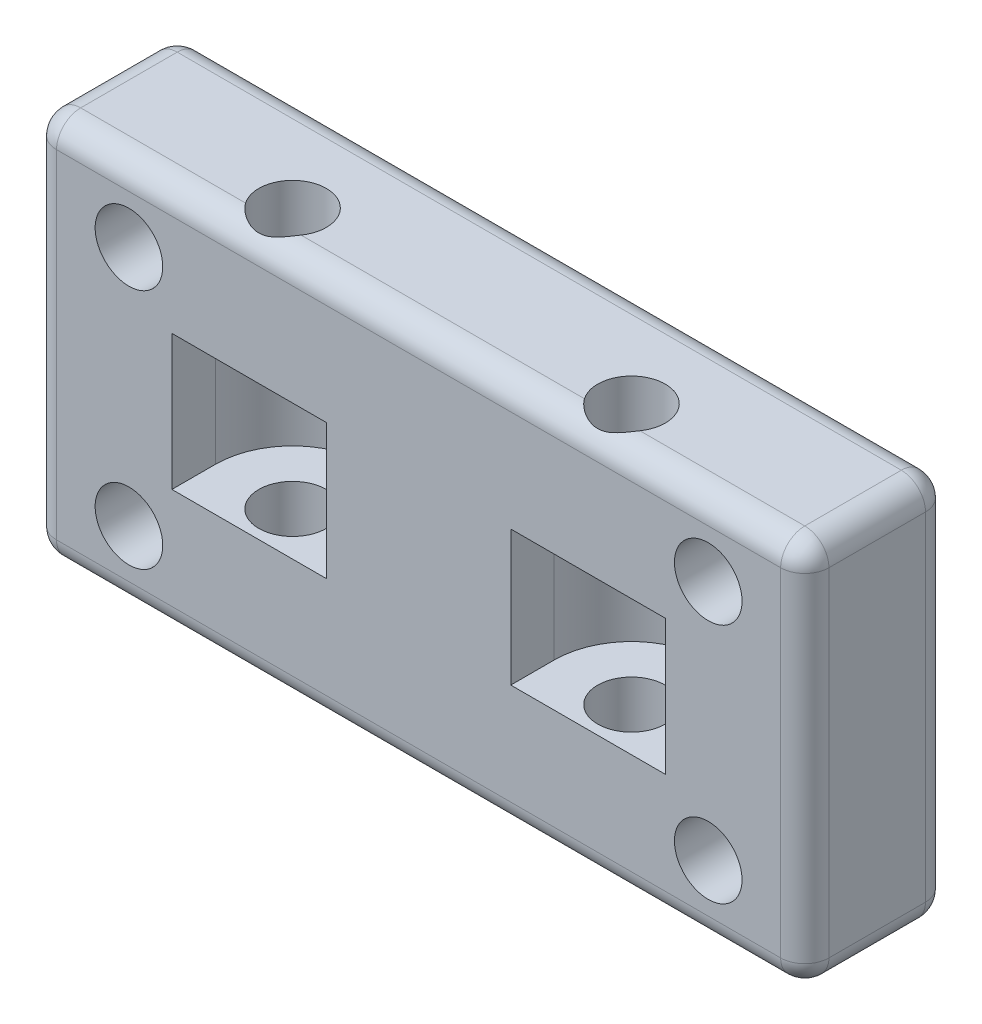
from build123d import *

# Parameters (mm, degrees)
SKETCH1_W               = 50.8
SKETCH1_H               = 25.4
BOSS_EXTRUDE1_DEPTH     = 9.525
CUT_EXTRUDE2_DEPTH      = 4.445
SKETCH2_R               = 2.2225
CUT_EXTRUDE1_DEPTH      = 9.525
CUT_EXTRUDE3_START      = -38.162422217
SKETCH5_R               = 2.2225
CUT_EXTRUDE3_DEPTH      = 41.337422217
MIRROR2_COPY_1_SKETCH_R = 2.2225
MIRROR2_COPY_1_DEPTH    = 9.525
FILLET1_R               = 1.5875


with BuildPart() as part:
    # Sketch1 → Boss-Extrude1 (new body)
    with BuildSketch(Plane.XY):
        Rectangle(SKETCH1_W, SKETCH1_H)
    extrude(amount=BOSS_EXTRUDE1_DEPTH)

    # Sketch4 → Cut-Extrude2 (cut, symmetric)
    with BuildSketch(Plane(origin=(0, 0, 0), x_dir=(1, 0, 0), z_dir=(0, 1, 0))):
        with BuildLine():
            Line((-16.22425, -6.6675), (-16.22425, -9.525))
            Line((-16.22425, -9.525), (-6.06425, -9.525))
            Line((-6.06425, -9.525), (-6.06425, -6.6675))
            ThreePointArc((-6.06425, -6.6675), (-11.14425, -1.5875), (-16.22425, -6.6675))
        make_face()
    cut_extrude2 = extrude(amount=CUT_EXTRUDE2_DEPTH, both=True, mode=Mode.SUBTRACT)

    # Sketch2 → Cut-Extrude1 (cut)
    with BuildSketch(Plane.XY.offset(9.525)):
        with Locations((-19.05, 7.9375)):
            Circle(SKETCH2_R)
    cut_extrude1 = extrude(amount=-CUT_EXTRUDE1_DEPTH, mode=Mode.SUBTRACT)

    # Sketch5 → Cut-Extrude3 (cut)
    with BuildSketch(Plane(origin=(0, 12.7, 0), x_dir=(1, 0, 0), z_dir=(0, 1, 0)).offset(CUT_EXTRUDE3_START)):
        with Locations(Location((-11.14425, -6.6675, 0), (0, 0, 180))):
            Circle(SKETCH5_R)
    cut_extrude3 = extrude(amount=CUT_EXTRUDE3_DEPTH, mode=Mode.SUBTRACT)

    # Mirror1: Cut-Extrude1 across plane
    add(cut_extrude1.mirror(Plane.ZX), mode=Mode.SUBTRACT)

    # Mirror2: Cut-Extrude2, Cut-Extrude1, Cut-Extrude3 across plane
    add(cut_extrude2.mirror(Plane.ZY), mode=Mode.SUBTRACT)
    add(cut_extrude1.mirror(Plane.ZY), mode=Mode.SUBTRACT)
    add(cut_extrude3.mirror(Plane.ZY), mode=Mode.SUBTRACT)

    # Mirror2 copy 1 sketch → Mirror2 copy 1 (cut)
    with BuildSketch(Plane(origin=(0, 0, 9.525), x_dir=(-1, 0, 0), z_dir=(0, 0, 1))):
        with Locations((-19.05, 7.9375)):
            Circle(MIRROR2_COPY_1_SKETCH_R)
    extrude(amount=-MIRROR2_COPY_1_DEPTH, mode=Mode.SUBTRACT)

    # Fillet1
    # the kernel refuses this fillet: 1.5875 mm, written as the material it takes off along each edge
    with BuildSketch(Plane(origin=(-23.8125, 11.1125, 7.9375), x_dir=(0, 1, 0), z_dir=(-1, 0, 0))) as fillet1_piece_1_section:
        Polygon((0, 0), (FILLET1_R, 0), (FILLET1_R, -FILLET1_R), (0, -FILLET1_R), align=None)
    fillet1_piece_1 = extrude(amount=FILLET1_R, mode=Mode.PRIVATE)
    fillet1_piece_1 = fillet1_piece_1 - Plane(origin=(-23.8125, 11.1125, 7.9375), x_dir=(0, -0.7071067811865475, -0.7071067811865475), z_dir=(-1, 0, 0)) * Sphere(FILLET1_R, mode=Mode.PRIVATE)
    add(fillet1_piece_1, mode=Mode.SUBTRACT)
    with BuildSketch(Plane(origin=(23.8125, 11.1125, 7.9375), x_dir=(0, 0, 1), z_dir=(0, 1, 0))) as fillet1_piece_2_section:
        Polygon((0, 0), (FILLET1_R, 0), (FILLET1_R, FILLET1_R), (0, FILLET1_R), align=None)
    fillet1_piece_2 = extrude(amount=FILLET1_R, mode=Mode.PRIVATE)
    fillet1_piece_2 = fillet1_piece_2 - Plane(origin=(23.8125, 11.1125, 7.9375), x_dir=(-0.7071067811865475, 0, -0.7071067811865475), z_dir=(0, 1, 0)) * Sphere(FILLET1_R, mode=Mode.PRIVATE)
    add(fillet1_piece_2, mode=Mode.SUBTRACT)
    with BuildSketch(Plane(origin=(-23.8125, -11.1125, 7.9375), x_dir=(0, -1, 0), z_dir=(-1, 0, 0))) as fillet1_piece_3_section:
        Polygon((0, 0), (FILLET1_R, 0), (FILLET1_R, FILLET1_R), (0, FILLET1_R), align=None)
    fillet1_piece_3 = extrude(amount=FILLET1_R, mode=Mode.PRIVATE)
    fillet1_piece_3 = fillet1_piece_3 - Plane(origin=(-23.8125, -11.1125, 7.9375), x_dir=(0, 0.7071067811865475, -0.7071067811865475), z_dir=(-1, 0, 0)) * Sphere(FILLET1_R, mode=Mode.PRIVATE)
    add(fillet1_piece_3, mode=Mode.SUBTRACT)
    with BuildSketch(Plane(origin=(23.8125, -11.1125, 7.9375), x_dir=(0, 0, 1), z_dir=(0, -1, 0))) as fillet1_piece_4_section:
        Polygon((0, 0), (FILLET1_R, 0), (FILLET1_R, -FILLET1_R), (0, -FILLET1_R), align=None)
    fillet1_piece_4 = extrude(amount=FILLET1_R, mode=Mode.PRIVATE)
    fillet1_piece_4 = fillet1_piece_4 - Plane(origin=(23.8125, -11.1125, 7.9375), x_dir=(-0.7071067811865475, 0, -0.7071067811865475), z_dir=(0, -1, 0)) * Sphere(FILLET1_R, mode=Mode.PRIVATE)
    add(fillet1_piece_4, mode=Mode.SUBTRACT)
    with BuildSketch(Plane(origin=(-23.8125, -11.1125, 1.5875), x_dir=(0, -1, 0), z_dir=(-1, 0, 0))) as fillet1_piece_5_section:
        Polygon((0, 0), (FILLET1_R, 0), (FILLET1_R, -FILLET1_R), (0, -FILLET1_R), align=None)
    fillet1_piece_5 = extrude(amount=FILLET1_R, mode=Mode.PRIVATE)
    fillet1_piece_5 = fillet1_piece_5 - Plane(origin=(-23.8125, -11.1125, 1.5875), x_dir=(0, 0.7071067811865475, 0.7071067811865475), z_dir=(-1, 0, 0)) * Sphere(FILLET1_R, mode=Mode.PRIVATE)
    add(fillet1_piece_5, mode=Mode.SUBTRACT)
    with BuildSketch(Plane(origin=(-23.8125, 11.1125, 1.5875), x_dir=(0, 1, 0), z_dir=(-1, 0, 0))) as fillet1_piece_6_section:
        Polygon((0, 0), (FILLET1_R, 0), (FILLET1_R, FILLET1_R), (0, FILLET1_R), align=None)
    fillet1_piece_6 = extrude(amount=FILLET1_R, mode=Mode.PRIVATE)
    fillet1_piece_6 = fillet1_piece_6 - Plane(origin=(-23.8125, 11.1125, 1.5875), x_dir=(0, -0.7071067811865475, 0.7071067811865475), z_dir=(-1, 0, 0)) * Sphere(FILLET1_R, mode=Mode.PRIVATE)
    add(fillet1_piece_6, mode=Mode.SUBTRACT)
    with BuildSketch(Plane(origin=(23.8125, 11.1125, 1.5875), x_dir=(0, 0, -1), z_dir=(0, 1, 0))) as fillet1_piece_7_section:
        Polygon((0, 0), (FILLET1_R, 0), (FILLET1_R, -FILLET1_R), (0, -FILLET1_R), align=None)
    fillet1_piece_7 = extrude(amount=FILLET1_R, mode=Mode.PRIVATE)
    fillet1_piece_7 = fillet1_piece_7 - Plane(origin=(23.8125, 11.1125, 1.5875), x_dir=(-0.7071067811865475, 0, 0.7071067811865475), z_dir=(0, 1, 0)) * Sphere(FILLET1_R, mode=Mode.PRIVATE)
    add(fillet1_piece_7, mode=Mode.SUBTRACT)
    with BuildSketch(Plane(origin=(23.8125, -11.1125, 1.5875), x_dir=(0, 0, -1), z_dir=(0, -1, 0))) as fillet1_piece_8_section:
        Polygon((0, 0), (FILLET1_R, 0), (FILLET1_R, FILLET1_R), (0, FILLET1_R), align=None)
    fillet1_piece_8 = extrude(amount=FILLET1_R, mode=Mode.PRIVATE)
    fillet1_piece_8 = fillet1_piece_8 - Plane(origin=(23.8125, -11.1125, 1.5875), x_dir=(-0.7071067811865475, 0, 0.7071067811865475), z_dir=(0, -1, 0)) * Sphere(FILLET1_R, mode=Mode.PRIVATE)
    add(fillet1_piece_8, mode=Mode.SUBTRACT)
    with BuildSketch(Plane(origin=(-23.8125, 12.7, 9.525), x_dir=(0, 0, -1), z_dir=(1, 0, 0)), Plane(origin=(23.8125, -12.7, 9.525), x_dir=(0, 0, -1), z_dir=(-1, 0, 0))) as fillet1_piece_9:
        with BuildLine():
            CenterArc((FILLET1_R, -FILLET1_R), FILLET1_R, 90, 90)
            Line((0, -FILLET1_R), (0, 0))
            Line((0, 0), (FILLET1_R, 0))
        make_face()
    extrude(amount=47.625, mode=Mode.SUBTRACT)
    with BuildSketch(Plane(origin=(-25.4, -11.1125, 9.525), x_dir=(0, 0, -1), z_dir=(0, 1, 0)), Plane(origin=(25.4, 11.1125, 0), x_dir=(-1, 0, 0), z_dir=(0, -1, 0))) as fillet1_piece_10:
        with BuildLine():
            CenterArc((FILLET1_R, -FILLET1_R), FILLET1_R, 90, 90)
            Line((0, -FILLET1_R), (0, 0))
            Line((0, 0), (FILLET1_R, 0))
        make_face()
    extrude(amount=22.225, mode=Mode.SUBTRACT)
    with BuildSketch(Plane(origin=(-25.4, -11.1125, 0), x_dir=(0, 0, 1), z_dir=(0, 1, 0)), Plane(origin=(25.4, 11.1125, 9.525), x_dir=(-1, 0, 0), z_dir=(0, -1, 0))) as fillet1_piece_11:
        with BuildLine():
            CenterArc((FILLET1_R, FILLET1_R), FILLET1_R, 180, 90)
            Line((0, FILLET1_R), (0, 0))
            Line((0, 0), (FILLET1_R, 0))
        make_face()
    extrude(amount=22.225, mode=Mode.SUBTRACT)
    with BuildSketch(Plane(origin=(-23.8125, 12.7, 0), x_dir=(0, 0, 1), z_dir=(1, 0, 0)), Plane(origin=(23.8125, -12.7, 0), x_dir=(0, 0, 1), z_dir=(-1, 0, 0))) as fillet1_piece_12:
        with BuildLine():
            CenterArc((FILLET1_R, FILLET1_R), FILLET1_R, 180, 90)
            Line((0, FILLET1_R), (0, 0))
            Line((0, 0), (FILLET1_R, 0))
        make_face()
    extrude(amount=47.625, mode=Mode.SUBTRACT)
    with BuildSketch(Plane(origin=(-25.4, -12.7, 1.5875), x_dir=(0, 1, 0), z_dir=(0, 0, 1)), Plane(origin=(25.4, -12.7, 1.5875), x_dir=(-1, 0, 0), z_dir=(0, 0, 1))) as fillet1_piece_13:
        with BuildLine():
            CenterArc((FILLET1_R, -FILLET1_R), FILLET1_R, 90, 90)
            Line((0, -FILLET1_R), (0, 0))
            Line((0, 0), (FILLET1_R, 0))
        make_face()
    extrude(amount=6.35, mode=Mode.SUBTRACT)
    with BuildSketch(Plane(origin=(-25.4, 12.7, 1.5875), x_dir=(0, -1, 0), z_dir=(0, 0, 1)), Plane(origin=(25.4, 12.7, 1.5875), x_dir=(-1, 0, 0), z_dir=(0, 0, 1))) as fillet1_piece_14:
        with BuildLine():
            CenterArc((FILLET1_R, FILLET1_R), FILLET1_R, 180, 90)
            Line((0, FILLET1_R), (0, 0))
            Line((0, 0), (FILLET1_R, 0))
        make_face()
    extrude(amount=6.35, mode=Mode.SUBTRACT)


solid = part.part
